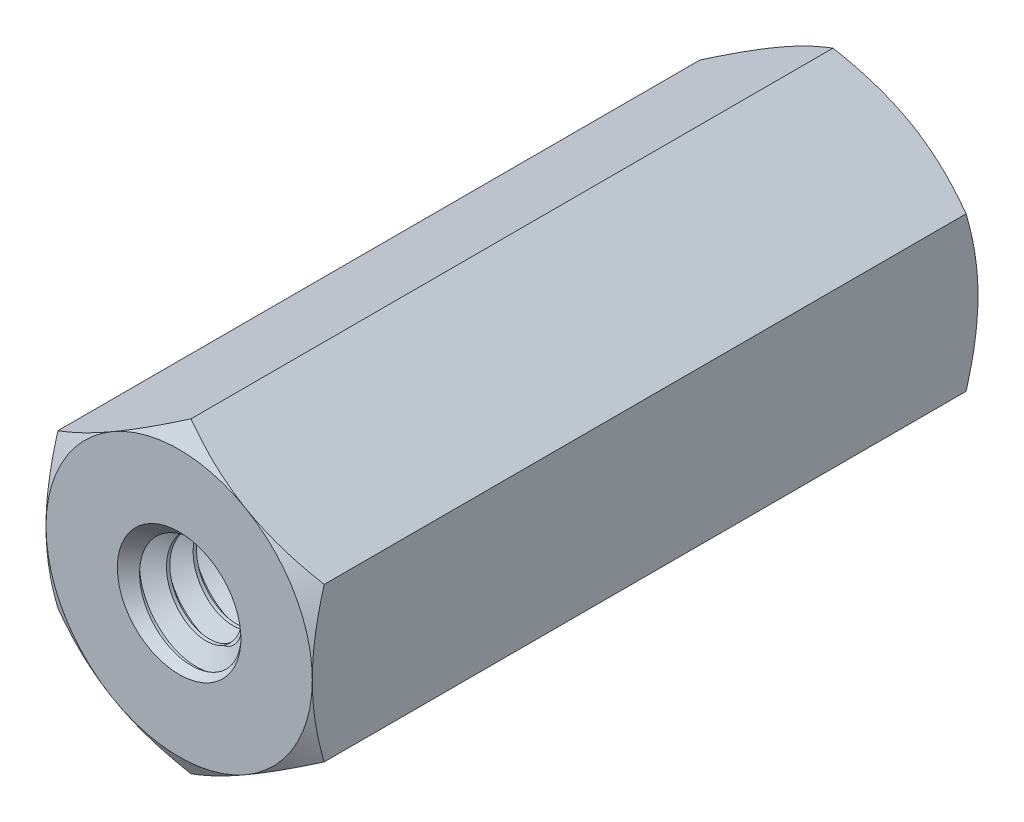
from build123d import *

# Parameters (mm, degrees)
EXTRUDE1_DEPTH          = 7.9375
EXTRUDE1_DEPTH_BACK     = 7.9375
SKETCH1_R               = 1.4224
SWEEP1_PITCH            = 0.635
EXTRUDE2_DEPTH          = 18.207768079
SKETCH8_OUTSIDE_W       = 75.254
SKETCH8_OUTSIDE_H       = 76.236
SKETCH8_OUTSIDE_R       = 3.175
EXTRUDE4_DEPTH          = 18.207768079
EXTRUDE4_DRAFT          = -60
MIRROR1_COPY_1_SKETCH_W = 75.254
MIRROR1_COPY_1_SKETCH_H = 76.236
MIRROR1_COPY_1_SKETCH_R = 3.175
MIRROR1_COPY_1_DEPTH    = 18.207768079
MIRROR1_COPY_1_DRAFT    = -60


with BuildPart() as part:
    # Sketch1 → Extrude1 (new, two sides: drawn at the far end of the back side and taken through both)
    with BuildSketch(Plane.XY.offset(-EXTRUDE1_DEPTH_BACK)):
        Polygon((0, 3.666174209), (-3.175, 1.833087105), (-3.175, -1.833087105), (0, -3.666174209), (3.175, -1.833087105), (3.175, 1.833087105), align=None)
        Circle(SKETCH1_R, mode=Mode.SUBTRACT)
    extrude(amount=EXTRUDE1_DEPTH + EXTRUDE1_DEPTH_BACK)

    # Sweep1: the profile of Sketch12 profile screwed along a right-hand helix of 26 turns, 6 arcs to a turn; built about Z, then put on its axis
    sweep1_z = Axis((0, 0, 0), (0, 0, 1))
    sweep1_corners = [(1.4227, 0, -0.555798205), (1.4227, 0, 0.000173205), (1.009955401, 0, -0.238125), (1.009955401, 0, -0.3175)]
    with BuildLine(mode=Mode.PRIVATE) as sweep1_profile:
        Line(sweep1_corners[0], sweep1_corners[1])
        Line(sweep1_corners[1], sweep1_corners[2])
        Line(sweep1_corners[2], sweep1_corners[3])
        Line(sweep1_corners[3], sweep1_corners[0])
    sweep1_cap = Face(sweep1_profile.wire())
    sweep1_turn_angles = [0, 30, 60, 90, 120, 150, 180, 210, 240, 270, 300, 330, 360]
    sweep1_turn_weights = [1, 0.8660254037844387, 1, 0.8660254037844387, 1, 0.8660254037844387, 1, 0.8660254037844387, 1, 0.8660254037844387, 1, 0.8660254037844387, 1]
    sweep1_turn_rails = [Edge.make_bspline([Vector(p[0], p[1], 0).rotate(sweep1_z, sweep1_turn_angles[k]) / sweep1_turn_weights[k] + Vector(0, 0, p[2] + SWEEP1_PITCH * sweep1_turn_angles[k] / 360) for k in range(13)], [0, 0, 0, 1, 1, 2, 2, 3, 3, 4, 4, 5, 5, 6, 6, 6], 2, sweep1_turn_weights) for p in sweep1_corners]
    sweep1_turn_sides = [Face.make_surface_from_curves(sweep1_turn_rails[p[0]], sweep1_turn_rails[p[1]]) for p in [(0, 1), (1, 2), (2, 3), (3, 0)]]
    sweep1 = Plane(origin=(0, 0, -7.9375), x_dir=(0, 1, 0), z_dir=(0, 0, 1)) * Solid(Shell([*[p.moved(Location((0, 0, SWEEP1_PITCH * i))) for i in range(26) for p in sweep1_turn_sides], sweep1_cap, sweep1_cap.rotate(sweep1_z, 9360).moved(Location((0, 0, SWEEP1_PITCH * 9360 / 360)))]))
    add(sweep1)

    # Sketch6 → Extrude2 (cut, through all)
    with BuildSketch(Plane(origin=(0, 0, -7.9375), x_dir=(-1, 0, 0), z_dir=(0, 0, -1))):
        Polygon((0, 3.666174209), (-3.175, 1.833087105), (-3.175, -1.833087105), (0, -3.666174209), (3.175, -1.833087105), (3.175, 1.833087105), align=None)
    extrude2 = extrude(amount=EXTRUDE2_DEPTH, mode=Mode.SUBTRACT)

    # Extrude3 cone 1 section (through the dimple's axis) → Extrude3 (revolve, cut)
    with BuildSketch(Plane(origin=(0, 0, -7.9375), x_dir=(0, 1, 0), z_dir=(1, 0, 0))):
        Polygon((0, 0), (1.4732, 0), (0, 1.579813584), align=None)
    extrude3 = revolve(axis=Axis((0, 0, -7.9375), (0, 0, 1)), mode=Mode.SUBTRACT)


with BuildPart() as extrude4_tool:
    # Sketch8 outside → Extrude4 (with draft: the straight prism first)
    with BuildSketch(Plane(origin=(0, 0, -7.9375), x_dir=(-1, 0, 0), z_dir=(0, 0, -1))):
        Rectangle(SKETCH8_OUTSIDE_W, SKETCH8_OUTSIDE_H)
        Circle(SKETCH8_OUTSIDE_R, mode=Mode.SUBTRACT)
    extrude(amount=-EXTRUDE4_DEPTH)
    # Extrude4: the draft: its side faces are tilted about the plane it starts from
    extrude4_sides = [extrude4_tool.faces().sort_by_distance(p)[0] for p in [
        (0, -38.118, 1.16638404),
        (-37.627, 0, 1.16638404),
        (0, 38.118, 1.16638404),
        (37.627, 0, 1.16638404),
        (3.175, 0, 1.16638404),
    ]]
    draft(extrude4_sides, Plane(origin=(0, 0, -7.9375), x_dir=(-1, 0, 0), z_dir=(0, 0, -1)), EXTRUDE4_DRAFT)


with BuildPart() as part_1:
    add(part.part)

    # Extrude4: cut by extrude4_tool
    add(extrude4_tool.part, mode=Mode.SUBTRACT)

    # Mirror1: Extrude2, Extrude3 across plane
    add(extrude2.mirror(Plane.XY), mode=Mode.SUBTRACT)
    add(extrude3.mirror(Plane.XY), mode=Mode.SUBTRACT)


with BuildPart() as mirror1_copy_1_tool:
    # Mirror1 copy 1 sketch → Mirror1 copy 1 (with draft: the straight prism first)
    with BuildSketch(Plane(origin=(0, 0, 7.9375), x_dir=(-1, 0, 0), z_dir=(0, 0, 1))):
        Rectangle(MIRROR1_COPY_1_SKETCH_W, MIRROR1_COPY_1_SKETCH_H)
        Circle(MIRROR1_COPY_1_SKETCH_R, mode=Mode.SUBTRACT)
    extrude(amount=-MIRROR1_COPY_1_DEPTH)
    # Mirror1 copy 1: the draft: its side faces are tilted about the plane it starts from
    mirror1_copy_1_sides = [mirror1_copy_1_tool.faces().sort_by_distance(p)[0] for p in [
        (0, -38.118, -1.16638404),
        (-37.627, 0, -1.16638404),
        (0, 38.118, -1.16638404),
        (37.627, 0, -1.16638404),
        (3.175, 0, -1.16638404),
    ]]
    draft(mirror1_copy_1_sides, Plane(origin=(0, 0, 7.9375), x_dir=(-1, 0, 0), z_dir=(0, 0, 1)), MIRROR1_COPY_1_DRAFT)


with BuildPart() as part_2:
    add(part_1.part)

    # Mirror1 copy 1: cut by mirror1_copy_1_tool
    add(mirror1_copy_1_tool.part, mode=Mode.SUBTRACT)


solid = part_2.part
